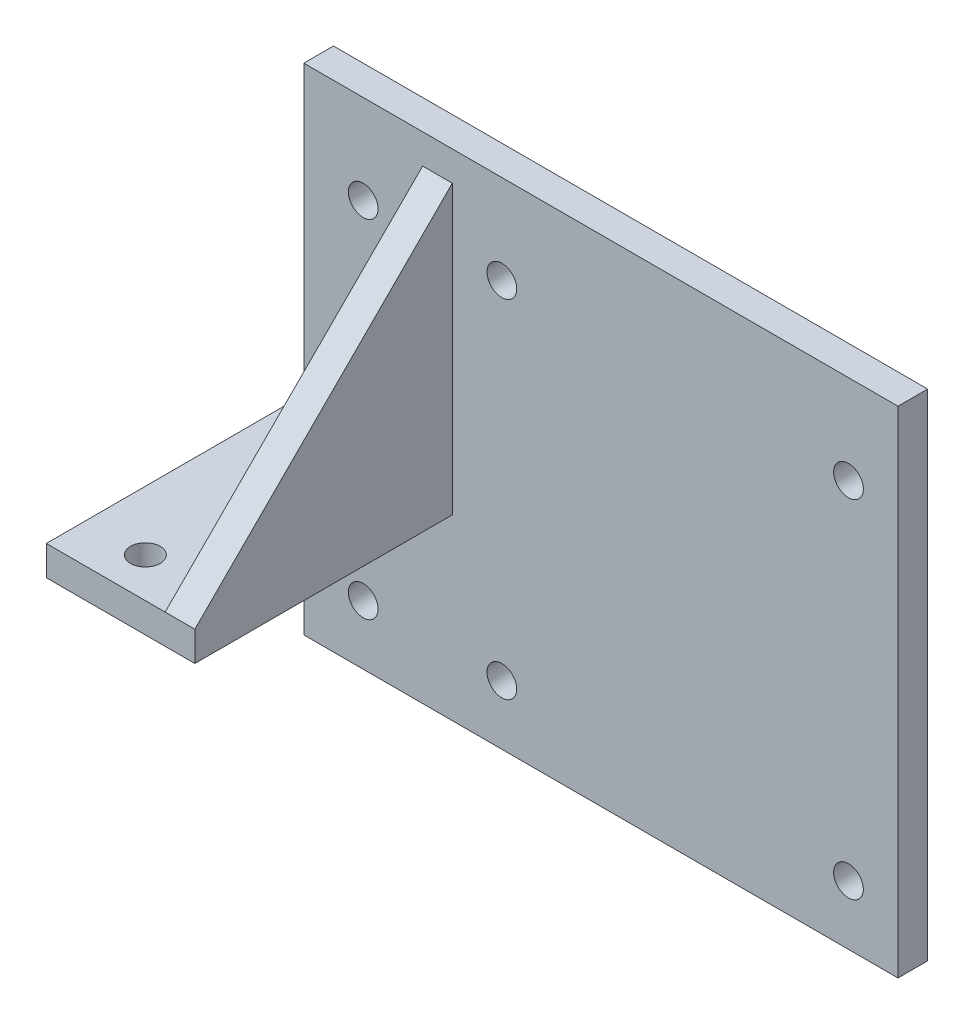
from build123d import *

# Parameters (mm, degrees)
SKETCH1_W           = 60
SKETCH1_H           = 50
BOSS_EXTRUDE1_DEPTH = 3
SKETCH2_R           = 1.5
CUT_EXTRUDE1_DEPTH  = 79.160092119
SKETCH3_W           = 12
SKETCH3_H           = 3
BOSS_EXTRUDE2_DEPTH = 26
SKETCH5_R           = 1.5
CUT_EXTRUDE2_DEPTH  = 10
BOSS_EXTRUDE3_DEPTH = 3


with BuildPart() as part:
    # Sketch1 → Boss-Extrude1 (new body)
    with BuildSketch(Plane.XY):
        with Locations((30, 25)):
            Rectangle(SKETCH1_W, SKETCH1_H)
    extrude(amount=BOSS_EXTRUDE1_DEPTH)

    # Sketch2 → Cut-Extrude1 (cut, through all)
    with BuildSketch(Plane.XY.offset(3)):
        with Locations((20, 6)):
            Circle(SKETCH2_R)
        with Locations((20, 41)):
            Circle(SKETCH2_R)
        with Locations((55, 41)):
            Circle(SKETCH2_R)
        with Locations((55, 6)):
            Circle(SKETCH2_R)
        with Locations((6, 6)):
            Circle(SKETCH2_R)
        with Locations((6, 41)):
            Circle(SKETCH2_R)
    extrude(amount=-CUT_EXTRUDE1_DEPTH, mode=Mode.SUBTRACT)

    # Sketch3 → Boss-Extrude2 (add)
    with BuildSketch(Plane.XY.offset(3)):
        with Locations((6, 19.5)):
            Rectangle(SKETCH3_W, SKETCH3_H)
    extrude(amount=BOSS_EXTRUDE2_DEPTH)

    # Sketch5 → Cut-Extrude2 (cut)
    with BuildSketch(Plane(origin=(0, 21, 0), x_dir=(1, 0, 0), z_dir=(0, 1, 0))):
        with Locations((6, -7)):
            Circle(SKETCH5_R)
        with Locations((6, -25)):
            Circle(SKETCH5_R)
    extrude(amount=-CUT_EXTRUDE2_DEPTH, mode=Mode.SUBTRACT)

    # Sketch6 → Boss-Extrude3 (add)
    with BuildSketch(Plane(origin=(12, 0, 0), x_dir=(0, 0, -1), z_dir=(1, 0, 0))):
        Polygon((-3, 18), (-29, 18), (-29, 21), (-3, 47), align=None)
    extrude(amount=BOSS_EXTRUDE3_DEPTH)


solid = part.part
